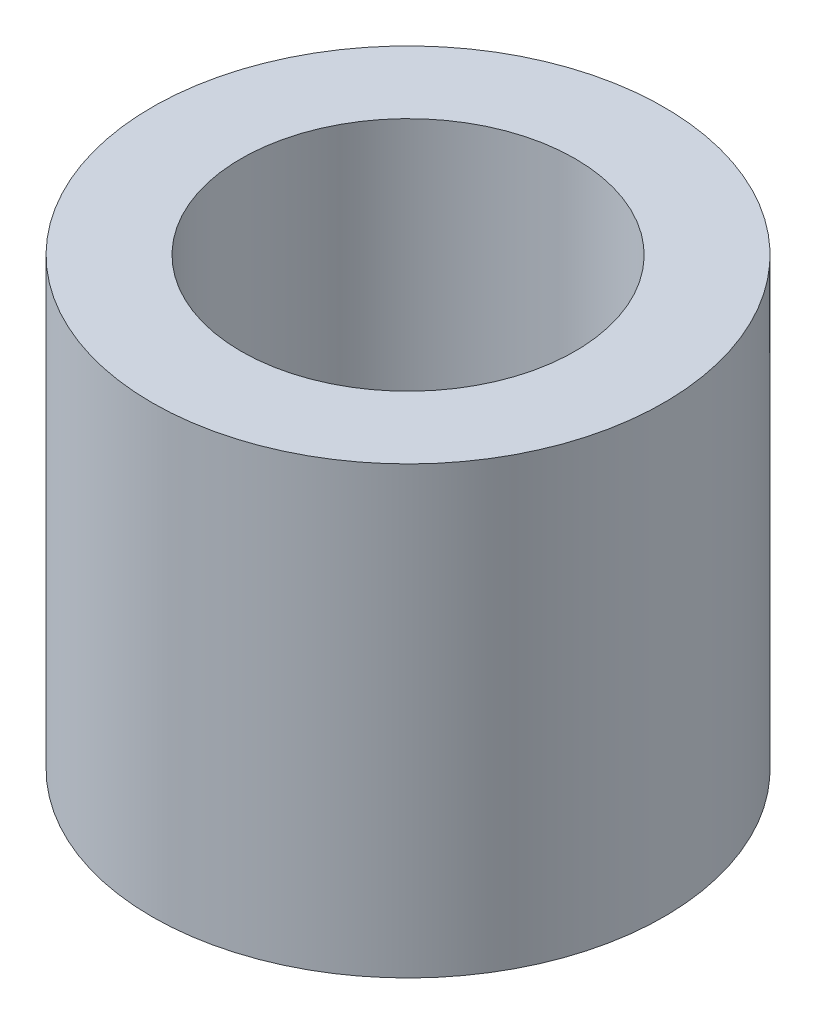
from build123d import *

# Parameters (mm, degrees)
SKETCH1_R           = 2.3
SKETCH1_R_2         = 1.5
BOSS_EXTRUDE1_DEPTH = 4


with BuildPart() as part:
    # Sketch1 → Boss-Extrude1 (new body)
    with BuildSketch(Plane(origin=(0, 0, 0), x_dir=(1, 0, 0), z_dir=(0, 1, 0))):
        Circle(SKETCH1_R)
        Circle(SKETCH1_R_2, mode=Mode.SUBTRACT)
    extrude(amount=BOSS_EXTRUDE1_DEPTH)


solid = part.part
